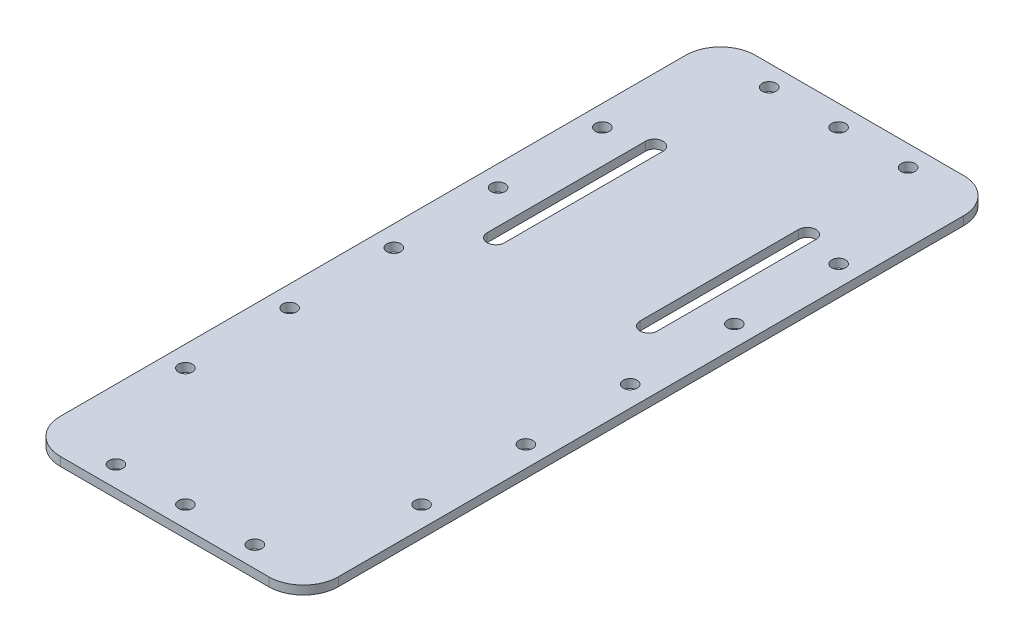
from build123d import *

# Parameters (mm, degrees)
SKETCH1_W           = 101.6
SKETCH1_H           = 254
BOSS_EXTRUDE1_DEPTH = 3.175
SKETCH2_R           = 2.54
CUT_EXTRUDE1_DEPTH  = 223.663234681
FILLET1_R           = 12.7
CUT_EXTRUDE7_DEPTH  = 223.663234681


with BuildPart() as part:
    # Sketch1 → Boss-Extrude1 (new body)
    with BuildSketch(Plane(origin=(0, 0, 0), x_dir=(1, 0, 0), z_dir=(0, 1, 0))):
        with Locations((20.100372359, -84.049692378)):
            Rectangle(SKETCH1_W, SKETCH1_H)
    extrude(amount=BOSS_EXTRUDE1_DEPTH)

    # Sketch2 → Cut-Extrude1 (cut, through all)
    with BuildSketch(Plane(origin=(0, 3.175, 0), x_dir=(1, 0, 0), z_dir=(0, 1, 0))):
        with Locations((-5.299627641, 35.330307622)):
            Circle(SKETCH2_R)
        with Locations((20.100372359, 35.330307622)):
            Circle(SKETCH2_R)
        with Locations((45.500372359, 35.330307622)):
            Circle(SKETCH2_R)
        with Locations((-23.079627641, -84.049692378)):
            Circle(SKETCH2_R)
        with Locations((-23.079627641, -45.949692378)):
            Circle(SKETCH2_R)
        with Locations((-23.079627641, -7.849692378)):
            Circle(SKETCH2_R)
        with Locations((63.280372359, -7.849692378)):
            Circle(SKETCH2_R)
        with Locations((63.280372359, -45.949692378)):
            Circle(SKETCH2_R)
        with Locations((63.280372359, -84.049692378)):
            Circle(SKETCH2_R)
        with Locations((63.280372359, -122.149692378)):
            Circle(SKETCH2_R)
        with Locations((63.280372359, -160.249692378)):
            Circle(SKETCH2_R)
        with Locations((-23.079627641, -160.249692378)):
            Circle(SKETCH2_R)
        with Locations((-23.079627641, -122.149692378)):
            Circle(SKETCH2_R)
        with Locations((45.500372359, -203.429692378)):
            Circle(SKETCH2_R)
        with Locations((20.100372359, -203.429692378)):
            Circle(SKETCH2_R)
        with Locations((-5.299627641, -203.429692378)):
            Circle(SKETCH2_R)
    extrude(amount=-CUT_EXTRUDE1_DEPTH, mode=Mode.SUBTRACT)

    # Fillet1
    fillet1_edges = [part.edges().sort_by_distance(p)[0] for p in [
        (-30.699627641, 1.5875, 211.049692378),
        (70.900372359, 1.5875, 211.049692378),
        (70.900372359, 1.5875, -42.950307622),
        (-30.699627641, 1.5875, -42.950307622),
    ]]
    fillet(fillet1_edges, radius=FILLET1_R)

    # Sketch4 → Cut-Extrude7 (cut, through all)
    with BuildSketch(Plane(origin=(0, 0, 0), x_dir=(1, 0, 0), z_dir=(0, 1, 0))):
        with BuildLine():
            Line((51.42781247, -4.28096808), (51.42781247, -62.218416676))
            ThreePointArc((51.42781247, -62.218416676), (48.25281247, -65.393416676), (45.07781247, -62.218416676))
            Line((45.07781247, -62.218416676), (45.07781247, -4.28096808))
            ThreePointArc((45.07781247, -4.28096808), (48.25281247, -1.10596808), (51.42781247, -4.28096808))
        make_face()
        with BuildLine():
            Line((-10.80218753, -4.28096808), (-10.80218753, -62.218416676))
            ThreePointArc((-10.80218753, -62.218416676), (-7.62718753, -65.393416676), (-4.45218753, -62.218416676))
            Line((-4.45218753, -62.218416676), (-4.45218753, -4.28096808))
            ThreePointArc((-4.45218753, -4.28096808), (-7.62718753, -1.10596808), (-10.80218753, -4.28096808))
        make_face()
    extrude(amount=CUT_EXTRUDE7_DEPTH, mode=Mode.SUBTRACT)


solid = part.part
